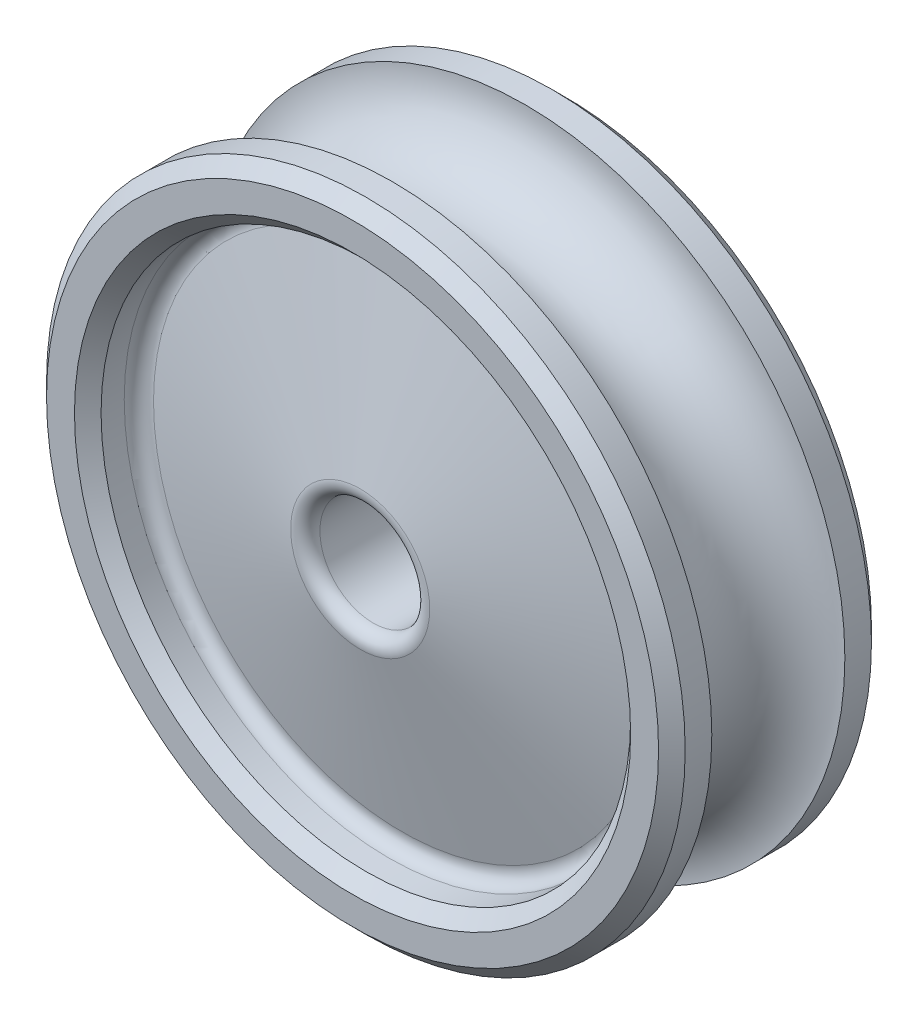
from build123d import *

# Parameters (mm, degrees)
SKETCH1_R           = 152.4
BOSS_EXTRUDE1_DEPTH = 101.6
SKETCH2_R           = 31.75
SKETCH4_R           = 25.4
CUT_EXTRUDE1_DEPTH  = 239.273120599
CHAMFER1_SIZE       = 6.35
FILLET1_R           = 6.35
FILLET2_R           = 6.35
FILLET3_R           = 6.35


with BuildPart() as part:
    # Sketch1 → Boss-Extrude1 (new body)
    with BuildSketch(Plane.XY):
        Circle(SKETCH1_R)
    extrude(amount=BOSS_EXTRUDE1_DEPTH)

    # Cut-Sweep1: sweep along a path in Sketch3
    with BuildLine(Plane.XY.offset(50.8)) as cut_sweep1_path:
        CenterArc((0, 0), 152.4, 0, 360)
    # Sketch2 → Cut-Sweep1 (sweep, cut)
    with BuildSketch(Plane(origin=(0, 0, 0), x_dir=(0, 0, -1), z_dir=(1, 0, 0))):
        with Locations((-50.8, 152.4)):
            Circle(SKETCH2_R)
    sweep(path=cut_sweep1_path.line, mode=Mode.SUBTRACT)

    # Sketch4 → Cut-Extrude1 (cut, through all)
    with BuildSketch(Plane.XY.offset(101.6)):
        Circle(SKETCH4_R)
    extrude(amount=-CUT_EXTRUDE1_DEPTH, mode=Mode.SUBTRACT)

    # Sketch6 → Cut-Revolve5 (revolve, cut)
    with BuildSketch(Plane(origin=(0, 0, 0), x_dir=(0, 0, -1), z_dir=(1, 0, 0))):
        Polygon((-25.4, 126.369282727), (0, 126.369282727), (0, 17.580887087), align=None)
    cut_revolve5 = revolve(axis=Axis((0, 0, 0), (0, 0, 1)), mode=Mode.SUBTRACT)

    # Mirror1: Cut-Revolve5 across plane
    add(cut_revolve5.mirror(Plane.XY.offset(50.8)), mode=Mode.SUBTRACT)

    # Chamfer1
    chamfer1_edges = [part.edges().sort_by_distance(p)[0] for p in [
        (0, -126.369282727, 0),
        (-152.4, 0, 0),
        (0, -126.369282727, 101.6),
        (-152.4, 0, 101.6),
    ]]
    chamfer(chamfer1_edges, length=CHAMFER1_SIZE)

    # Fillet1
    fillet1_edges = [part.edges().sort_by_distance(p)[0] for p in [
        (0, -126.369282727, 76.2),
    ]]
    fillet(fillet1_edges, radius=FILLET1_R)

    # Fillet2
    fillet2_edges = [part.edges().sort_by_distance(p)[0] for p in [
        (0, -126.369282727, 25.4),
    ]]
    fillet(fillet2_edges, radius=FILLET2_R)

    # Fillet3
    # the kernel refuses this fillet: 6.35 mm, written as the material it takes off along each edge
    with BuildSketch(Plane(origin=(0, 0, 1.82561262), x_dir=(0, 1, 0), z_dir=(1, 0, 0))) as fillet3_piece_1:
        with BuildLine():
            CenterArc((25.4 + FILLET3_R, FILLET3_R * 1.26037575366), FILLET3_R, 180, 103.14203418)
            Line((25.4, FILLET3_R * 1.26037575366), (25.4, 0))
            Line((25.4, 0), (25.4 + FILLET3_R * 1.22736578908, FILLET3_R * 0.28656632777))
        make_face()
    fillet3_piece_1_solid = revolve(axis=Axis((0, 0, 1.82561262), (0, 0, 1)), revolution_arc=270, mode=Mode.PRIVATE)
    with BuildSketch(Plane(origin=(0, 0, 99.77438738), x_dir=(0, 1, 0), z_dir=(1, 0, 0))) as fillet3_piece_2:
        with BuildLine():
            CenterArc((25.4 + FILLET3_R, -FILLET3_R * 1.26037575366), FILLET3_R, 76.85796582, 103.14203418)
            Line((25.4 + FILLET3_R * 1.22736578908, -FILLET3_R * 0.28656632777), (25.4, 0))
            Line((25.4, 0), (25.4, -FILLET3_R * 1.26037575366))
        make_face()
    fillet3_piece_2_solid = revolve(axis=Axis((0, 0, 99.77438738), (0, 0, 1)), revolution_arc=270, mode=Mode.PRIVATE)
    with BuildSketch(Plane(origin=(0, 0, 99.77438738), x_dir=(1, 0, 0), z_dir=(0, -1, 0))) as fillet3_piece_3:
        with BuildLine():
            CenterArc((25.4 + FILLET3_R, -FILLET3_R * 1.26037575366), FILLET3_R, 76.85796582, 103.14203418)
            Line((25.4 + FILLET3_R * 1.22736578908, -FILLET3_R * 0.28656632777), (25.4, 0))
            Line((25.4, 0), (25.4, -FILLET3_R * 1.26037575366))
        make_face()
    fillet3_piece_3_solid = revolve(axis=Axis((0, 0, 99.77438738), (0, 0, 1)), revolution_arc=90, mode=Mode.PRIVATE)
    with BuildSketch(Plane(origin=(0, 0, 1.82561262), x_dir=(1, 0, 0), z_dir=(0, -1, 0))) as fillet3_piece_4:
        with BuildLine():
            CenterArc((25.4 + FILLET3_R, FILLET3_R * 1.26037575366), FILLET3_R, 180, 103.14203418)
            Line((25.4, FILLET3_R * 1.26037575366), (25.4, 0))
            Line((25.4, 0), (25.4 + FILLET3_R * 1.22736578908, FILLET3_R * 0.28656632777))
        make_face()
    fillet3_piece_4_solid = revolve(axis=Axis((0, 0, 1.82561262), (0, 0, 1)), revolution_arc=90, mode=Mode.PRIVATE)
    add([fillet3_piece_1_solid, fillet3_piece_2_solid, fillet3_piece_3_solid, fillet3_piece_4_solid], mode=Mode.SUBTRACT)


solid = part.part
